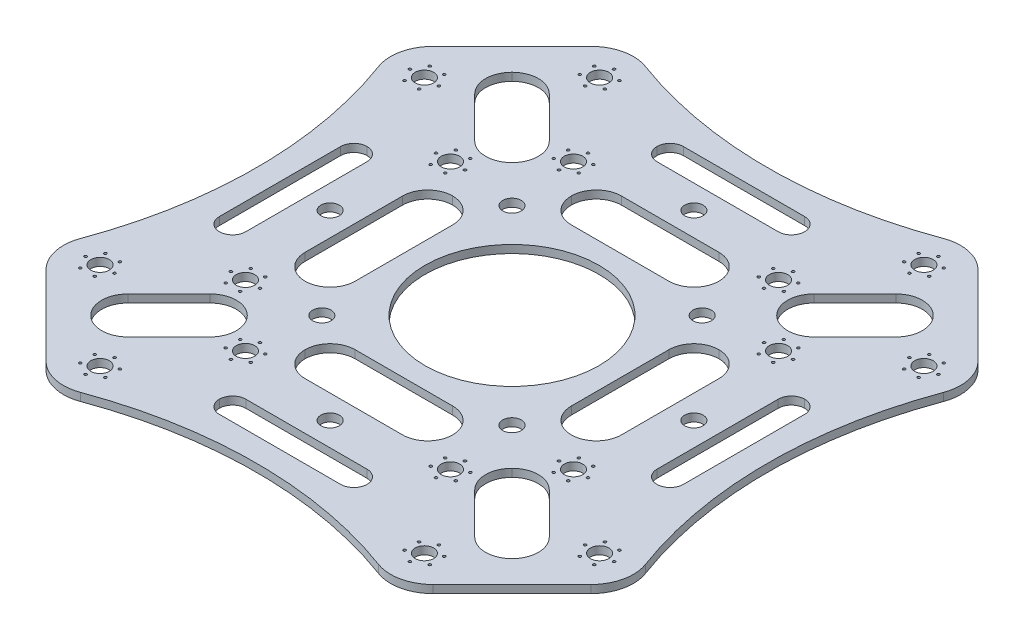
from build123d import *

# Parameters (mm, degrees)
BOSS_EXTRUDE1_DEPTH         = 1.5
FILLET1_R                   = 8
SKETCH2_R                   = 16.5
SKETCH2_W                   = 28
SKETCH2_H                   = 5
SKETCH2_H_2                 = 9.5
CUT_EXTRUDE1_DEPTH          = 77.452226041
FILLET2_R                   = 4.75
FILLET3_R                   = 2.5
FILLET4_R                   = 5
CIRPATTERN1_COUNT           = 4
FILLET2_OF_CIRPATTERN1_R    = 4.75
FILLET3_OF_CIRPATTERN1_R    = 2.5
FILLET4_OF_CIRPATTERN1_R    = 5
SKETCH3_R                   = 1.75
CUT_EXTRUDE2_DEPTH          = 77.452226041
CIRPATTERN2_COUNT           = 4
SKETCH4_R                   = 0.25
CUT_EXTRUDE3_DEPTH          = 77.452226041
CIRPATTERN3_COUNT           = 4
CIRPATTERN3_COPY_1_SKETCH_R = 0.25
CIRPATTERN3_COPY_1_DEPTH    = 77.452226041
CIRPATTERN3_COPY_2_SKETCH_R = 0.25
CIRPATTERN3_COPY_2_DEPTH    = 77.452226041
CIRPATTERN3_COPY_3_SKETCH_R = 0.25
CIRPATTERN3_COPY_3_DEPTH    = 77.452226041
SKETCH5_R                   = 0.25
CUT_EXTRUDE4_DEPTH          = 77.452226041
CIRPATTERN4_COUNT           = 4
CIRPATTERN4_COPY_1_SKETCH_R = 0.25
CIRPATTERN4_COPY_1_DEPTH    = 77.452226041
CIRPATTERN4_COPY_2_SKETCH_R = 0.25
CIRPATTERN4_COPY_2_DEPTH    = 77.452226041
CIRPATTERN4_COPY_3_SKETCH_R = 0.25
CIRPATTERN4_COPY_3_DEPTH    = 77.452226041
CUT_EXTRUDE5_DEPTH          = 0.1


with BuildPart() as part:
    # Sketch1 → Boss-Extrude1 (new body)
    with BuildSketch(Plane(origin=(0, 0, 0), x_dir=(1, 0, 0), z_dir=(0, 1, 0))):
        with BuildLine():
            Line((32.93654628, 55.451801369), (55.451801369, 32.93654628))
            ThreePointArc((55.451801369, 32.93654628), (48.5, 0), (55.451801369, -32.93654628))
            Line((55.451801369, -32.93654628), (32.93654628, -55.451801369))
            ThreePointArc((32.93654628, -55.451801369), (0, -48.5), (-32.93654628, -55.451801369))
            Line((-32.93654628, -55.451801369), (-55.451801369, -32.93654628))
            ThreePointArc((-55.451801369, -32.93654628), (-48.5, 0), (-55.451801369, 32.93654628))
            Line((-55.451801369, 32.93654628), (-32.93654628, 55.451801369))
            ThreePointArc((-32.93654628, 55.451801369), (0, 48.5), (32.93654628, 55.451801369))
        make_face()
    extrude(amount=BOSS_EXTRUDE1_DEPTH)

    # Fillet1
    fillet1_edges = [part.edges().sort_by_distance(p)[0] for p in [
        (32.93654628, 0.75, -55.451801369),
        (55.451801369, 0.75, -32.93654628),
        (55.451801369, 0.75, 32.93654628),
        (32.93654628, 0.75, 55.451801369),
        (-32.93654628, 0.75, 55.451801369),
        (-55.451801369, 0.75, 32.93654628),
        (-55.451801369, 0.75, -32.93654628),
        (-32.93654628, 0.75, -55.451801369),
    ]]
    fillet(fillet1_edges, radius=FILLET1_R)

    # Sketch2 → Cut-Extrude1 (cut, through all)
    with BuildSketch(Plane(origin=(0, 1.5, 0), x_dir=(1, 0, 0), z_dir=(0, 1, 0))):
        with Locations(Location((0, 0, 0), (0, 0, 270))):
            Circle(SKETCH2_R)
        with Locations((0, 41.5)):
            Rectangle(SKETCH2_W, SKETCH2_H)
        with Locations((0, 25.25)):
            Rectangle(SKETCH2_W, SKETCH2_H_2)
        Polygon((36.415999231, 43.487067043), (21.566756826, 28.637824638), (28.637824638, 21.566756826), (43.487067043, 36.415999231), align=None)
    cut_extrude1 = extrude(amount=-CUT_EXTRUDE1_DEPTH, mode=Mode.SUBTRACT)

    # Fillet2
    fillet2_edges = [part.edges().sort_by_distance(p)[0] for p in [
        (14, 0.75, -20.5),
        (14, 0.75, -30),
        (-14, 0.75, -20.5),
        (-14, 0.75, -30),
    ]]
    fillet(fillet2_edges, radius=FILLET2_R - 0.0001)  # a hair under: the kernel refuses the full size

    # Fillet3
    fillet3_edges = [part.edges().sort_by_distance(p)[0] for p in [
        (14, 0.75, -39),
        (14, 0.75, -44),
        (-14, 0.75, -39),
        (-14, 0.75, -44),
    ]]
    fillet(fillet3_edges, radius=FILLET3_R - 0.0001)  # a hair under: the kernel refuses the full size

    # Fillet4
    fillet4_edges = [part.edges().sort_by_distance(p)[0] for p in [
        (43.487067043, 0.75, -36.415999231),
        (21.566756826, 0.75, -28.637824638),
        (28.637824638, 0.75, -21.566756826),
        (36.415999231, 0.75, -43.487067043),
    ]]
    fillet(fillet4_edges, radius=FILLET4_R - 0.0001)  # a hair under: the kernel refuses the full size

    # CirPattern1: Cut-Extrude1 ×4 about axis
    cirpattern1_axis = Axis((0, 0, 0), (0, 1, 0))
    for i in range(1, CIRPATTERN1_COUNT):
        add(cut_extrude1.rotate(cirpattern1_axis, i * 360 / CIRPATTERN1_COUNT), mode=Mode.SUBTRACT)

    # Fillet2 of CirPattern1
    fillet2_of_cirpattern1_edges = [part.edges().sort_by_distance(p)[0] for p in [
        (-20.5, 0.75, -14),
        (-30, 0.75, -14),
        (-20.5, 0.75, 14),
        (-30, 0.75, 14),
        (-14, 0.75, 20.5),
        (-14, 0.75, 30),
        (14, 0.75, 20.5),
        (14, 0.75, 30),
        (20.5, 0.75, 14),
        (30, 0.75, 14),
        (20.5, 0.75, -14),
        (30, 0.75, -14),
    ]]
    fillet(fillet2_of_cirpattern1_edges, radius=FILLET2_OF_CIRPATTERN1_R - 0.0001)  # a hair under: the kernel refuses the full size

    # Fillet3 of CirPattern1
    fillet3_of_cirpattern1_edges = [part.edges().sort_by_distance(p)[0] for p in [
        (-39, 0.75, -14),
        (-44, 0.75, -14),
        (-39, 0.75, 14),
        (-44, 0.75, 14),
        (-14, 0.75, 39),
        (-14, 0.75, 44),
        (14, 0.75, 39),
        (14, 0.75, 44),
        (39, 0.75, 14),
        (44, 0.75, 14),
        (39, 0.75, -14),
        (44, 0.75, -14),
    ]]
    fillet(fillet3_of_cirpattern1_edges, radius=FILLET3_OF_CIRPATTERN1_R - 0.0001)  # a hair under: the kernel refuses the full size

    # Fillet4 of CirPattern1
    fillet4_of_cirpattern1_edges = [part.edges().sort_by_distance(p)[0] for p in [
        (-36.415999231, 0.75, -43.487067043),
        (-28.637824638, 0.75, -21.566756826),
        (-21.566756826, 0.75, -28.637824638),
        (-43.487067043, 0.75, -36.415999231),
        (-43.487067043, 0.75, 36.415999231),
        (-21.566756826, 0.75, 28.637824638),
        (-28.637824638, 0.75, 21.566756826),
        (-36.415999231, 0.75, 43.487067043),
        (36.415999231, 0.75, 43.487067043),
        (28.637824638, 0.75, 21.566756826),
        (21.566756826, 0.75, 28.637824638),
        (43.487067043, 0.75, 36.415999231),
    ]]
    fillet(fillet4_of_cirpattern1_edges, radius=FILLET4_OF_CIRPATTERN1_R - 0.0001)  # a hair under: the kernel refuses the full size

    # Sketch3 → Cut-Extrude2 (cut, through all)
    with BuildSketch(Plane(origin=(0, 1.5, 0), x_dir=(1, 0, 0), z_dir=(0, 1, 0))):
        with Locations(Location((30.759144982, 47.376154339, 0), (0, 0, 270))):
            Circle(SKETCH3_R)
        with Locations(Location((19.445436483, 31.112698372, 0), (0, 0, 270))):
            Circle(SKETCH3_R)
        with Locations(Location((18.03122292, 18.03122292, 0), (0, 0, 270))):
            Circle(SKETCH3_R)
        with Locations(Location((0, 34.5, 0), (0, 0, 270))):
            Circle(SKETCH3_R)
        with Locations(Location((47.376154339, 30.759144982, 0), (0, 0, 90))):
            Circle(SKETCH3_R)
        with Locations(Location((31.112698372, 19.445436483, 0), (0, 0, 90))):
            Circle(SKETCH3_R)
    cut_extrude2 = extrude(amount=-CUT_EXTRUDE2_DEPTH, mode=Mode.SUBTRACT)

    # CirPattern2: Cut-Extrude2 ×4 about axis
    cirpattern2_axis = Axis((0, 0, 0), (0, 1, 0))
    for i in range(1, CIRPATTERN2_COUNT):
        add(cut_extrude2.rotate(cirpattern2_axis, i * 360 / CIRPATTERN2_COUNT), mode=Mode.SUBTRACT)

    # Sketch4 → Cut-Extrude3 (cut, through all)
    with BuildSketch(Plane(origin=(0, 1.5, 0), x_dir=(1, 0, 0), z_dir=(0, 1, 0))):
        with Locations(Location((30.759144982, 50.126154339, 0), (0, 0, 270))):
            Circle(SKETCH4_R)
        with Locations(Location((33.140714842, 48.751154339, 0), (0, 0, 270))):
            Circle(SKETCH4_R)
        with Locations(Location((33.140714842, 46.001154339, 0), (0, 0, 270))):
            Circle(SKETCH4_R)
        with Locations(Location((30.759144982, 44.626154339, 0), (0, 0, 270))):
            Circle(SKETCH4_R)
        with Locations(Location((28.377575121, 46.001154339, 0), (0, 0, 270))):
            Circle(SKETCH4_R)
        with Locations(Location((28.377575121, 48.751154339, 0), (0, 0, 270))):
            Circle(SKETCH4_R)
    cut_extrude3 = extrude(amount=-CUT_EXTRUDE3_DEPTH, mode=Mode.SUBTRACT)

    # Mirror1: Cut-Extrude3 across plane
    add(cut_extrude3.mirror(Plane(origin=(0, 0, 0), x_dir=(-0.7071067811865466, 0, 0.7071067811865486), z_dir=(0.7071067811865487, 0, 0.7071067811865465))), mode=Mode.SUBTRACT)

    # CirPattern3: Cut-Extrude3 ×4 about axis
    cirpattern3_axis = Axis((0, 0, 0), (0, 1, 0))
    for i in range(1, CIRPATTERN3_COUNT):
        add(cut_extrude3.rotate(cirpattern3_axis, i * 360 / CIRPATTERN3_COUNT), mode=Mode.SUBTRACT)

    # CirPattern3 copy 1 sketch → CirPattern3 copy 1 (cut, through all)
    with BuildSketch(Plane(origin=(0, 1.5, 0), x_dir=(-1, 0, 0), z_dir=(0, 1, 0))):
        with Locations((30.759144982, -50.126154339)):
            Circle(CIRPATTERN3_COPY_1_SKETCH_R)
        with Locations((33.140714842, -48.751154339)):
            Circle(CIRPATTERN3_COPY_1_SKETCH_R)
        with Locations((33.140714842, -46.001154339)):
            Circle(CIRPATTERN3_COPY_1_SKETCH_R)
        with Locations((30.759144982, -44.626154339)):
            Circle(CIRPATTERN3_COPY_1_SKETCH_R)
        with Locations((28.377575121, -46.001154339)):
            Circle(CIRPATTERN3_COPY_1_SKETCH_R)
        with Locations((28.377575121, -48.751154339)):
            Circle(CIRPATTERN3_COPY_1_SKETCH_R)
    extrude(amount=-CIRPATTERN3_COPY_1_DEPTH, mode=Mode.SUBTRACT)

    # CirPattern3 copy 2 sketch → CirPattern3 copy 2 (cut, through all)
    with BuildSketch(Plane.ZX.offset(1.5)):
        with Locations((30.759144982, -50.126154339)):
            Circle(CIRPATTERN3_COPY_2_SKETCH_R)
        with Locations((33.140714842, -48.751154339)):
            Circle(CIRPATTERN3_COPY_2_SKETCH_R)
        with Locations((33.140714842, -46.001154339)):
            Circle(CIRPATTERN3_COPY_2_SKETCH_R)
        with Locations((30.759144982, -44.626154339)):
            Circle(CIRPATTERN3_COPY_2_SKETCH_R)
        with Locations((28.377575121, -46.001154339)):
            Circle(CIRPATTERN3_COPY_2_SKETCH_R)
        with Locations((28.377575121, -48.751154339)):
            Circle(CIRPATTERN3_COPY_2_SKETCH_R)
    extrude(amount=-CIRPATTERN3_COPY_2_DEPTH, mode=Mode.SUBTRACT)

    # CirPattern3 copy 3 sketch → CirPattern3 copy 3 (cut, through all)
    with BuildSketch(Plane(origin=(0, 1.5, 0), x_dir=(1, 0, 0), z_dir=(0, 1, 0))):
        with Locations((30.759144982, -50.126154339)):
            Circle(CIRPATTERN3_COPY_3_SKETCH_R)
        with Locations((33.140714842, -48.751154339)):
            Circle(CIRPATTERN3_COPY_3_SKETCH_R)
        with Locations((33.140714842, -46.001154339)):
            Circle(CIRPATTERN3_COPY_3_SKETCH_R)
        with Locations((30.759144982, -44.626154339)):
            Circle(CIRPATTERN3_COPY_3_SKETCH_R)
        with Locations((28.377575121, -46.001154339)):
            Circle(CIRPATTERN3_COPY_3_SKETCH_R)
        with Locations((28.377575121, -48.751154339)):
            Circle(CIRPATTERN3_COPY_3_SKETCH_R)
    extrude(amount=-CIRPATTERN3_COPY_3_DEPTH, mode=Mode.SUBTRACT)

    # Sketch5 → Cut-Extrude4 (cut, through all)
    with BuildSketch(Plane(origin=(0, 1.5, 0), x_dir=(1, 0, 0), z_dir=(0, 1, 0))):
        with Locations(Location((19.445436483, 33.862698372, 0), (0, 0, 270))):
            Circle(SKETCH5_R)
        with Locations(Location((21.827006343, 32.487698372, 0), (0, 0, 270))):
            Circle(SKETCH5_R)
        with Locations(Location((21.827006343, 29.737698372, 0), (0, 0, 270))):
            Circle(SKETCH5_R)
        with Locations(Location((19.445436483, 28.362698372, 0), (0, 0, 270))):
            Circle(SKETCH5_R)
        with Locations(Location((17.063866622, 29.737698372, 0), (0, 0, 270))):
            Circle(SKETCH5_R)
        with Locations(Location((17.063866622, 32.487698372, 0), (0, 0, 270))):
            Circle(SKETCH5_R)
    cut_extrude4 = extrude(amount=-CUT_EXTRUDE4_DEPTH, mode=Mode.SUBTRACT)

    # Mirror2: Cut-Extrude4 across plane
    add(cut_extrude4.mirror(Plane(origin=(0, 0, 0), x_dir=(-0.7071067811865466, 0, 0.7071067811865486), z_dir=(0.7071067811865487, 0, 0.7071067811865465))), mode=Mode.SUBTRACT)

    # CirPattern4: Cut-Extrude4 ×4 about axis
    cirpattern4_axis = Axis((0, 0, 0), (0, 1, 0))
    for i in range(1, CIRPATTERN4_COUNT):
        add(cut_extrude4.rotate(cirpattern4_axis, i * 360 / CIRPATTERN4_COUNT), mode=Mode.SUBTRACT)

    # CirPattern4 copy 1 sketch → CirPattern4 copy 1 (cut, through all)
    with BuildSketch(Plane(origin=(0, 1.5, 0), x_dir=(-1, 0, 0), z_dir=(0, 1, 0))):
        with Locations((19.445436483, -33.862698372)):
            Circle(CIRPATTERN4_COPY_1_SKETCH_R)
        with Locations((21.827006343, -32.487698372)):
            Circle(CIRPATTERN4_COPY_1_SKETCH_R)
        with Locations((21.827006343, -29.737698372)):
            Circle(CIRPATTERN4_COPY_1_SKETCH_R)
        with Locations((19.445436483, -28.362698372)):
            Circle(CIRPATTERN4_COPY_1_SKETCH_R)
        with Locations((17.063866622, -29.737698372)):
            Circle(CIRPATTERN4_COPY_1_SKETCH_R)
        with Locations((17.063866622, -32.487698372)):
            Circle(CIRPATTERN4_COPY_1_SKETCH_R)
    extrude(amount=-CIRPATTERN4_COPY_1_DEPTH, mode=Mode.SUBTRACT)

    # CirPattern4 copy 2 sketch → CirPattern4 copy 2 (cut, through all)
    with BuildSketch(Plane.ZX.offset(1.5)):
        with Locations((19.445436483, -33.862698372)):
            Circle(CIRPATTERN4_COPY_2_SKETCH_R)
        with Locations((21.827006343, -32.487698372)):
            Circle(CIRPATTERN4_COPY_2_SKETCH_R)
        with Locations((21.827006343, -29.737698372)):
            Circle(CIRPATTERN4_COPY_2_SKETCH_R)
        with Locations((19.445436483, -28.362698372)):
            Circle(CIRPATTERN4_COPY_2_SKETCH_R)
        with Locations((17.063866622, -29.737698372)):
            Circle(CIRPATTERN4_COPY_2_SKETCH_R)
        with Locations((17.063866622, -32.487698372)):
            Circle(CIRPATTERN4_COPY_2_SKETCH_R)
    extrude(amount=-CIRPATTERN4_COPY_2_DEPTH, mode=Mode.SUBTRACT)

    # CirPattern4 copy 3 sketch → CirPattern4 copy 3 (cut, through all)
    with BuildSketch(Plane(origin=(0, 1.5, 0), x_dir=(1, 0, 0), z_dir=(0, 1, 0))):
        with Locations((19.445436483, -33.862698372)):
            Circle(CIRPATTERN4_COPY_3_SKETCH_R)
        with Locations((21.827006343, -32.487698372)):
            Circle(CIRPATTERN4_COPY_3_SKETCH_R)
        with Locations((21.827006343, -29.737698372)):
            Circle(CIRPATTERN4_COPY_3_SKETCH_R)
        with Locations((19.445436483, -28.362698372)):
            Circle(CIRPATTERN4_COPY_3_SKETCH_R)
        with Locations((17.063866622, -29.737698372)):
            Circle(CIRPATTERN4_COPY_3_SKETCH_R)
        with Locations((17.063866622, -32.487698372)):
            Circle(CIRPATTERN4_COPY_3_SKETCH_R)
    extrude(amount=-CIRPATTERN4_COPY_3_DEPTH, mode=Mode.SUBTRACT)

    # Sketch6 → Cut-Extrude5 (cut)
    # profile 1 of 6: a face of its own
    with BuildSketch(Plane.XZ):
        Polygon((0.262920673, 16.464242788), (1.218549679, 19.847155449), (1.275340545, 19.839443109), (2.294070513, 16.82041266), (4.065104167, 19.462239583), (4.12119391, 19.454527244), (4.149238782, 15.939102564), (3.809895833, 15.984675481), (3.805689103, 18.496794872), (2.252704327, 16.195713141), (2.166466346, 16.20693109), (1.266225962, 18.85927484), (0.595252404, 16.419370994), align=None)
    # profile 2 of 6: a face of its own
    with BuildSketch(Plane.XZ):
        Polygon((5.979676764, 19.04771511), (7.863591027, 18.366224725), (7.746503688, 18.042306456), (6.190714425, 18.605307257), (5.818418752, 17.576761584), (7.3608867, 17.018668635), (7.244500482, 16.696853732), (5.702032534, 17.25494668), (5.235085418, 15.9655837), (6.777553367, 15.407490751), (6.660466027, 15.083572482), (4.789873079, 15.760155014), align=None)
    # profile 3 of 6: a face of its own
    with BuildSketch(Plane.XZ):
        with BuildLine():
            Line((10.591728797, 16.894790702), (10.431171906, 16.606629645))
            Line((10.431171906, 16.606629645), (9.352145463, 17.206789901))
            Line((9.352145463, 17.206789901), (8.74146838, 16.465003042))
            add(Edge.make_bspline(
                [(8.74146838, 16.465003042), (8.778527567, 16.455893859), (8.850192644, 16.438278515), (8.951979839, 16.405030687), (9.045481047, 16.368526036), (9.102779227, 16.338602187), (9.130590976, 16.324077561)],
                knots=[0, 0, 0, 0, 1.102800941, 2.132597077, 3.093588268, 4, 4, 4, 4], degree=3))
            add(Edge.make_bspline(
                [(9.130590976, 16.324077561), (9.163942134, 16.304357425), (9.229219201, 16.265759884), (9.318800813, 16.198408241), (9.399314347, 16.125351817), (9.470243074, 16.045739085), (9.532677381, 15.960630603), (9.584595178, 15.868661331), (9.627777672, 15.770839744), (9.660025493, 15.667461541), (9.683604955, 15.561251712), (9.695132297, 15.45383946), (9.697185893, 15.346216789), (9.685882613, 15.238479393), (9.665223374, 15.130337383), (9.63219091, 15.022303697), (9.589007802, 14.913903459), (9.551933916, 14.84392495), (9.533034886, 14.808252241)],
                knots=[0, 0, 0, 0, 1.057410552, 2.069633068, 3.054483779, 4.02176546, 4.976650336, 5.931343235, 6.900139714, 7.891195471, 8.883893885, 9.86638428, 10.836567245, 11.817730062, 12.819069236, 13.838729138, 14.898256245, 16, 16, 16, 16], degree=3))
            add(Edge.make_bspline(
                [(9.533034886, 14.808252241), (9.518799, 14.783794218), (9.490671259, 14.735469238), (9.444380928, 14.666203167), (9.393403166, 14.602034649), (9.340461385, 14.540327904), (9.282475269, 14.484024098), (9.222323577, 14.430040402), (9.157726238, 14.38134854), (9.090442276, 14.336564985), (9.021400264, 14.295808995), (8.950416332, 14.260617612), (8.878083004, 14.231310712), (8.805026244, 14.206781008), (8.731223006, 14.186528739), (8.656025524, 14.173725256), (8.579941208, 14.165163107), (8.477104051, 14.160370583), (8.346781938, 14.168560298), (8.191099931, 14.20222255), (8.034854319, 14.254942972), (7.935507026, 14.306515681), (7.884697547, 14.332891664)],
                knots=[0, 0, 0, 0, 0.883251166, 1.745157244, 2.597377281, 3.440084129, 4.28089441, 5.118121159, 5.961427697, 6.803091963, 7.640096218, 8.46221807, 9.273654946, 10.074131309, 10.866858574, 11.659619403, 12.452313102, 13.25557674, 14.8709734, 16.51055, 18.215380298, 20, 20, 20, 20], degree=3))
            add(Edge.make_bspline(
                [(7.884697547, 14.332891664), (7.854915187, 14.3503698), (7.796410097, 14.384704217), (7.715621287, 14.444342424), (7.64132863, 14.507927467), (7.57564073, 14.577668554), (7.51656957, 14.651616616), (7.466263619, 14.731403441), (7.422464188, 14.815684873), (7.386921911, 14.904489104), (7.359736696, 14.996080918), (7.340716135, 15.088973782), (7.329891125, 15.182591428), (7.328799228, 15.276725402), (7.335650439, 15.371572649), (7.352139464, 15.466734693), (7.37652439, 15.562738603), (7.399217431, 15.625463733), (7.410739213, 15.657310735)],
                knots=[0, 0, 0, 0, 1.072881763, 2.107591416, 3.117123134, 4.109009272, 5.081465591, 6.054979886, 7.036352308, 8.030710158, 9.023793053, 10.002714902, 10.975171221, 11.948875288, 12.925178214, 13.927336105, 14.947660533, 16, 16, 16, 16], degree=3))
            Line((7.410739213, 15.657310735), (7.721336169, 15.484834773))
            add(Edge.make_bspline(
                [(7.721336169, 15.484834773), (7.712056317, 15.453446861), (7.694100961, 15.392715162), (7.678398344, 15.302175288), (7.67428317, 15.216297421), (7.679063798, 15.134569533), (7.69707093, 15.056438216), (7.722695239, 14.979844534), (7.760041779, 14.905552938), (7.804945323, 14.833010426), (7.858787447, 14.765193055), (7.919918205, 14.704321881), (7.986938792, 14.650060674), (8.035997798, 14.620499905), (8.060679117, 14.605628042)],
                knots=[0, 0, 0, 0, 1.14545278, 2.21630842, 3.207675026, 4.151000993, 5.072313048, 6.006508688, 6.972664177, 7.97624879, 8.989693372, 9.996508863, 10.992054488, 12, 12, 12, 12], degree=3))
            add(Edge.make_bspline(
                [(8.060679117, 14.605628042), (8.085428267, 14.592673929), (8.134509054, 14.566984236), (8.21187924, 14.538790029), (8.290165631, 14.517705315), (8.370005419, 14.507053481), (8.450790159, 14.502971092), (8.533015374, 14.509149846), (8.616373274, 14.523100321), (8.700054073, 14.545719363), (8.782321191, 14.575154595), (8.860428985, 14.613641816), (8.93451087, 14.658099528), (9.002762179, 14.711537213), (9.066761898, 14.771396508), (9.126776322, 14.838008581), (9.18081036, 14.912939766), (9.212571022, 14.966678288), (9.228748028, 14.994049517)],
                knots=[0, 0, 0, 0, 0.976980117, 1.937478828, 2.876158392, 3.809939936, 4.751752239, 5.703111972, 6.690418528, 7.706561758, 8.734136858, 9.744101462, 10.750214268, 11.753428519, 12.772269276, 13.81526638, 14.887225748, 16, 16, 16, 16], degree=3))
            add(Edge.make_bspline(
                [(9.228748028, 14.994049517), (9.242050904, 15.01930935), (9.268161503, 15.068888805), (9.298917239, 15.145413392), (9.321949209, 15.221848674), (9.33568695, 15.29809257), (9.342205496, 15.374150614), (9.341024449, 15.449870719), (9.330797228, 15.525471902), (9.313457786, 15.600220303), (9.288313892, 15.673177415), (9.255259279, 15.742708803), (9.21483933, 15.80833545), (9.167621601, 15.870756605), (9.112024292, 15.928705482), (9.049076751, 15.98275894), (8.979419034, 16.033801358), (8.928720145, 16.063472358), (8.902726393, 16.078684933)],
                knots=[0, 0, 0, 0, 1.073853241, 2.107735903, 3.098478779, 4.073201836, 5.017651959, 5.967737226, 6.916885626, 7.883359146, 8.851352342, 9.815260991, 10.774664618, 11.747480969, 12.75533291, 13.790449479, 14.867144605, 16, 16, 16, 16], degree=3))
            add(Edge.make_bspline(
                [(8.902726393, 16.078684933), (8.879504701, 16.090906728), (8.831727619, 16.116052255), (8.754918366, 16.14899246), (8.671524723, 16.177858608), (8.582096551, 16.204984758), (8.486178252, 16.227463665), (8.384091584, 16.248185084), (8.275469403, 16.264708268), (8.200698562, 16.273363477), (8.162341778, 16.277803523)],
                knots=[0, 0, 0, 0, 0.815974876, 1.678813898, 2.596119407, 3.559720393, 4.584055445, 5.658932898, 6.799053154, 8, 8, 8, 8], degree=3))
            Line((8.162341778, 16.277803523), (9.279929919, 17.624658491))
            Line((9.279929919, 17.624658491), (10.591728797, 16.894790702))
        make_face()
    # profile 4 of 6: a face of its own
    with BuildSketch(Plane.XZ):
        Polygon((11.633896458, 16.231508412), (13.371977387, 14.848896232), (9.672157676, 13.206868989), (9.538944535, 13.500639021), (12.740967772, 14.928122995), (11.42776665, 15.972794469), align=None)
    # profile 5 of 6: a face of its own
    with BuildSketch(Plane.XZ):
        with BuildLine():
            Line((15.123076854, 13.116333277), (15.176362111, 12.779093694))
            Line((15.176362111, 12.779093694), (13.490865316, 12.518276386))
            add(Edge.make_bspline(
                [(13.490865316, 12.518276386), (13.518665846, 12.501803664), (13.573025804, 12.469593612), (13.64889942, 12.416464581), (13.716754845, 12.359679543), (13.756691894, 12.318339988), (13.776221886, 12.298124143)],
                knots=[0, 0, 0, 0, 1.071341404, 2.094854758, 3.068346979, 4, 4, 4, 4], degree=3))
            add(Edge.make_bspline(
                [(13.776221886, 12.298124143), (13.798204959, 12.272330243), (13.841474131, 12.221560239), (13.897392661, 12.139610472), (13.942989716, 12.053930523), (13.978983105, 11.964810098), (14.005902548, 11.872561272), (14.022679285, 11.776866503), (14.029466274, 11.677735027), (14.027259823, 11.576620356), (14.016475683, 11.475350248), (13.995283281, 11.37698226), (13.964984039, 11.28233289), (13.925422027, 11.191509629), (13.877099638, 11.104025049), (13.818120545, 11.021189414), (13.750827721, 10.941358521), (13.699806089, 10.892621689), (13.673858104, 10.867835681)],
                knots=[0, 0, 0, 0, 1.017734859, 2.003202432, 2.973849341, 3.928309984, 4.886070949, 5.85577769, 6.841320307, 7.866704966, 8.891031237, 9.896385737, 10.884551309, 11.872018108, 12.868431787, 13.881432235, 14.922563601, 16, 16, 16, 16], degree=3))
            add(Edge.make_bspline(
                [(13.673858104, 10.867835681), (13.636535312, 10.83619096), (13.563152921, 10.773972537), (13.440933516, 10.699325264), (13.312825711, 10.641905053), (13.178953328, 10.603434452), (13.041750861, 10.582586386), (12.902704519, 10.582168076), (12.763174138, 10.60081824), (12.624983697, 10.637796986), (12.491724807, 10.693051897), (12.366734646, 10.76446878), (12.250881414, 10.850870206), (12.183575204, 10.919932806), (12.149619322, 10.954774784)],
                knots=[0, 0, 0, 0, 1.033278756, 2.03158609, 3.015916617, 3.993277463, 4.967397967, 5.940816439, 6.922663473, 7.93545395, 8.956754461, 9.963706365, 10.972692908, 12, 12, 12, 12], degree=3))
            add(Edge.make_bspline(
                [(12.149619322, 10.954774784), (12.119488496, 10.990775889), (12.059898688, 11.061975362), (11.987004383, 11.180378434), (11.931406342, 11.306966652), (11.892353519, 11.439854509), (11.870013728, 11.576502629), (11.868221295, 11.714598727), (11.885004245, 11.852458831), (11.921866722, 11.988098244), (11.975579682, 12.118503344), (12.044654924, 12.24058505), (12.128645345, 12.353268452), (12.195664649, 12.418626918), (12.229547207, 12.451669816)],
                knots=[0, 0, 0, 0, 1.011198104, 1.999848962, 2.985722417, 3.983804425, 4.978701612, 5.961376515, 6.95134904, 7.963375367, 8.982377045, 9.984229461, 10.980898665, 12, 12, 12, 12], degree=3))
            add(Edge.make_bspline(
                [(12.229547207, 12.451669816), (12.256852998, 12.475237414), (12.312406592, 12.52318566), (12.406882425, 12.583847022), (12.508840041, 12.640700785), (12.622464958, 12.690882269), (12.750907179, 12.736603214), (12.898407658, 12.775348341), (13.065602446, 12.811474476), (13.184356175, 12.829762373), (13.246874931, 12.839390168)],
                knots=[0, 0, 0, 0, 0.782525581, 1.592047159, 2.432673418, 3.316584453, 4.286317662, 5.390866796, 6.62640303, 8, 8, 8, 8], degree=3))
            Line((13.246874931, 12.839390168), (15.123076854, 13.116333277))
        make_face()
        with BuildLine():
            add(Edge.make_bspline(
                [(13.494370925, 12.155095297), (13.477169204, 12.172968295), (13.443272456, 12.208187825), (13.387413578, 12.254419803), (13.329141713, 12.295030658), (13.266827493, 12.327951201), (13.201633575, 12.35481474), (13.133123591, 12.374311267), (13.061783269, 12.387676359), (12.988321678, 12.39469176), (12.914413405, 12.394465586), (12.842054763, 12.388537724), (12.772046736, 12.375031787), (12.704556223, 12.354750077), (12.639485171, 12.327126648), (12.577114169, 12.292345132), (12.516214971, 12.25200895), (12.479047294, 12.219794276), (12.460216277, 12.2034727)],
                knots=[0, 0, 0, 0, 1.033284532, 2.036132582, 3.017021461, 3.988919418, 4.967628917, 5.951174924, 6.95236549, 7.989591946, 9.022233346, 10.029472314, 11.011521551, 11.988484047, 12.96194313, 13.951693321, 14.962224698, 16, 16, 16, 16], degree=3))
            add(Edge.make_bspline(
                [(12.460216277, 12.2034727), (12.442341744, 12.18627159), (12.407119192, 12.152376046), (12.360909215, 12.096508407), (12.320217283, 12.03826883), (12.287554934, 11.975755913), (12.259538802, 11.910923868), (12.240589228, 11.842111244), (12.225963684, 11.770985411), (12.219293964, 11.697409011), (12.219415157, 11.623516133), (12.225410189, 11.55116637), (12.238712464, 11.481329605), (12.259440118, 11.414314954), (12.286061069, 11.34933781), (12.319874401, 11.286829089), (12.360770206, 11.226668437), (12.392761791, 11.189583591), (12.409034386, 11.170720297)],
                knots=[0, 0, 0, 0, 1.034592827, 2.038710633, 3.020841465, 3.993969992, 4.977649622, 5.962440946, 6.966748244, 8.005287986, 9.039236866, 10.047751151, 11.03104381, 11.999909903, 12.970836058, 13.957172002, 14.960910718, 16, 16, 16, 16], degree=3))
            add(Edge.make_bspline(
                [(12.409034386, 11.170720297), (12.426234735, 11.152844752), (12.460128777, 11.117620206), (12.516007343, 11.071424734), (12.574376071, 11.030560741), (12.636971162, 10.998177115), (12.702053729, 10.971021632), (12.770162054, 10.950611989), (12.841637501, 10.937494947), (12.915079146, 10.930408143), (12.988994176, 10.930649653), (13.061346009, 10.936587408), (13.131374082, 10.950040574), (13.198705377, 10.970495226), (13.263865136, 10.997283895), (13.326380559, 11.031074707), (13.386539395, 11.071976615), (13.42362449, 11.10396736), (13.442487912, 11.120239527)],
                knots=[0, 0, 0, 0, 1.034198846, 2.037934278, 3.019691108, 4.001060504, 4.971616924, 5.958781859, 6.96085834, 7.999002598, 9.032557743, 10.040687978, 11.023606193, 12.001433165, 12.971989585, 13.957949926, 14.961306411, 16, 16, 16, 16], degree=3))
            add(Edge.make_bspline(
                [(13.442487912, 11.120239527), (13.4606535, 11.137383319), (13.496463346, 11.171178896), (13.542565065, 11.227913523), (13.582790279, 11.286958204), (13.61698535, 11.348944309), (13.64333939, 11.414541949), (13.664049585, 11.48274531), (13.677101164, 11.554251655), (13.684206193, 11.627684697), (13.683959787, 11.701602038), (13.678023305, 11.773953271), (13.664569809, 11.843981499), (13.644115245, 11.911312753), (13.617326552, 11.976472523), (13.583535746, 12.038987943), (13.542633837, 12.09914678), (13.510643092, 12.136231875), (13.494370925, 12.155095297)],
                knots=[0, 0, 0, 0, 1.039329228, 2.04883095, 3.036941795, 4.012653423, 4.990547474, 5.976017911, 6.976374298, 8.01273655, 9.044517566, 10.050917317, 11.032148322, 12.008296826, 12.977187256, 13.961455166, 14.963089359, 16, 16, 16, 16], degree=3))
        make_face(mode=Mode.SUBTRACT)
    # profile 6 of 6: a face of its own
    with BuildSketch(Plane.XZ):
        with BuildLine():
            Line((15.692202739, 10.955095556), (15.499394246, 11.254474563))
            add(Edge.make_bspline(
                [(15.499394246, 11.254474563), (15.533593706, 11.266419905), (15.600394146, 11.289752264), (15.701199084, 11.315742394), (15.799892426, 11.333422599), (15.896223654, 11.343205881), (15.990513787, 11.345756809), (16.082446099, 11.339133113), (16.172463242, 11.32555825), (16.259524386, 11.302558453), (16.343507282, 11.273644741), (16.423082329, 11.236749381), (16.498372513, 11.193844509), (16.56964586, 11.144840581), (16.635637226, 11.088204342), (16.697461083, 11.02554134), (16.755595769, 10.956655334), (16.789669125, 10.906345738), (16.806986393, 10.880776646)],
                knots=[0, 0, 0, 0, 1.174121195, 2.293364013, 3.370972773, 4.422013105, 5.430055838, 6.4250274, 7.406695285, 8.377068436, 9.340434334, 10.282983711, 11.216258723, 12.147408839, 13.082711844, 14.031091103, 14.999331824, 16, 16, 16, 16], degree=3))
            add(Edge.make_bspline(
                [(16.806986393, 10.880776646), (16.829853717, 10.842228589), (16.875126986, 10.765910232), (16.926894042, 10.643629001), (16.960830334, 10.516321302), (16.980729758, 10.386515065), (16.984322041, 10.256952662), (16.971877314, 10.1310595), (16.943069827, 10.010310832), (16.89727027, 9.896757824), (16.838701506, 9.791537756), (16.768178723, 9.697704118), (16.687084331, 9.615435346), (16.624935585, 9.571383508), (16.593845368, 9.549346358)],
                knots=[0, 0, 0, 0, 1.078059655, 2.134368041, 3.183808378, 4.241942709, 5.288665535, 6.295113116, 7.278869882, 8.26604669, 9.233176389, 10.169261908, 11.084164229, 12, 12, 12, 12], degree=3))
            add(Edge.make_bspline(
                [(16.593845368, 9.549346358), (16.562329912, 9.530362935), (16.500463854, 9.493097743), (16.40011878, 9.454777624), (16.297818566, 9.43026119), (16.192387438, 9.422097613), (16.084630914, 9.428647266), (15.974346202, 9.450045876), (15.86176784, 9.487128951), (15.788382221, 9.521657662), (15.750395848, 9.539530652)],
                knots=[0, 0, 0, 0, 0.99399346, 1.95124762, 2.893230901, 3.832385813, 4.801766007, 5.806527293, 6.864599459, 8, 8, 8, 8], degree=3))
            add(Edge.make_bspline(
                [(15.750395848, 9.539530652), (15.757479338, 9.495700539), (15.771397861, 9.40957767), (15.770723843, 9.279734335), (15.757635313, 9.152571763), (15.734100983, 9.071161836), (15.722350977, 9.030516229)],
                knots=[0, 0, 0, 0, 1.032737647, 2.029251639, 3.016062711, 4, 4, 4, 4], degree=3))
            add(Edge.make_bspline(
                [(15.722350977, 9.030516229), (15.712735915, 9.00277206), (15.693699147, 8.947841645), (15.657944098, 8.869400327), (15.616146015, 8.795911287), (15.569197924, 8.727055923), (15.516446155, 8.662698019), (15.457227787, 8.604151945), (15.393394122, 8.549394873), (15.346871517, 8.517801321), (15.323412675, 8.501870396)],
                knots=[0, 0, 0, 0, 1.042126053, 2.06329533, 3.055464116, 4.040528978, 5.019036602, 6.004765266, 6.993910677, 8, 8, 8, 8], degree=3))
            add(Edge.make_bspline(
                [(15.323412675, 8.501870396), (15.281277826, 8.476993706), (15.197215501, 8.42736276), (15.059010325, 8.375417496), (14.914074024, 8.339658206), (14.788295567, 8.327241016), (14.686512224, 8.324820127), (14.61039082, 8.329347769), (14.535643623, 8.338229359), (14.462142225, 8.352534525), (14.389819619, 8.371175199), (14.318977848, 8.396021603), (14.249381929, 8.425468738), (14.158664962, 8.471498966), (14.049693417, 8.539528038), (13.931989786, 8.641108656), (13.821778588, 8.755836174), (13.76127437, 8.844460701), (13.730463957, 8.889590749)],
                knots=[0, 0, 0, 0, 1.283843007, 2.561367321, 3.863388662, 5.197594625, 5.873343536, 6.537719372, 7.19976296, 7.850251871, 8.504269001, 9.160819306, 9.821351084, 10.488842747, 11.83331583, 13.184422797, 14.56623062, 16, 16, 16, 16], degree=3))
            add(Edge.make_bspline(
                [(13.730463957, 8.889590749), (13.711241846, 8.920845624), (13.673448738, 8.982296674), (13.626620856, 9.07814186), (13.588203132, 9.174299195), (13.560269679, 9.271378952), (13.541174665, 9.368487489), (13.530981877, 9.466128481), (13.53132394, 9.564283388), (13.540297395, 9.662905389), (13.559143507, 9.760899147), (13.588386881, 9.857758414), (13.62684878, 9.95317707), (13.675952241, 10.046995351), (13.734300473, 10.139614104), (13.802430862, 10.231086479), (13.881561962, 10.320093597), (13.939298409, 10.3769967), (13.968845368, 10.406117191)],
                knots=[0, 0, 0, 0, 1.043349901, 2.051358214, 3.030445865, 3.985743681, 4.92067163, 5.842912562, 6.773741541, 7.708574919, 8.656556431, 9.607354992, 10.582733279, 11.578941296, 12.61566048, 13.694095619, 14.819940162, 16, 16, 16, 16], degree=3))
            Line((13.968845368, 10.406117191), (14.153941521, 10.119358377))
            add(Edge.make_bspline(
                [(14.153941521, 10.119358377), (14.135017325, 10.098048203), (14.098299531, 10.056701), (14.048613054, 9.993400946), (14.004454739, 9.931901425), (13.968249158, 9.8701511), (13.936367758, 9.810681426), (13.911595013, 9.751766073), (13.89276619, 9.694117953), (13.885479348, 9.655313244), (13.881906265, 9.63628546)],
                knots=[0, 0, 0, 0, 1.216923955, 2.361144653, 3.435628361, 4.447310857, 5.416133084, 6.315243634, 7.173884297, 8, 8, 8, 8], degree=3))
            add(Edge.make_bspline(
                [(13.881906265, 9.63628546), (13.878837687, 9.612485688), (13.872718075, 9.565022209), (13.872448653, 9.493350613), (13.878435602, 9.421877717), (13.893079651, 9.35092611), (13.913300279, 9.279752143), (13.940829587, 9.208575577), (13.975937004, 9.137918806), (14.003789936, 9.092251686), (14.017923893, 9.069077928)],
                knots=[0, 0, 0, 0, 0.964303424, 1.923093873, 2.876200428, 3.843979161, 4.831682514, 5.849344413, 6.908650859, 8, 8, 8, 8], degree=3))
            add(Edge.make_bspline(
                [(14.017923893, 9.069077928), (14.035301783, 9.043559135), (14.069225025, 8.9937441), (14.125611215, 8.925111642), (14.186049991, 8.864637692), (14.249990181, 8.811899896), (14.317013578, 8.766604943), (14.387503022, 8.728802599), (14.46223622, 8.700578252), (14.538912124, 8.678756926), (14.616434342, 8.664780503), (14.692974089, 8.658565803), (14.76789083, 8.65896306), (14.841015356, 8.667362786), (14.912164774, 8.683659988), (14.98131217, 8.707173106), (15.049158269, 8.736913318), (15.091613822, 8.76288148), (15.113076137, 8.776009018)],
                knots=[0, 0, 0, 0, 1.170244982, 2.284425979, 3.36217341, 4.407145424, 5.422194441, 6.42510259, 7.43222991, 8.444955449, 9.444412586, 10.413594824, 11.352947631, 12.280650339, 13.198567329, 14.114900336, 15.047036283, 16, 16, 16, 16], degree=3))
            add(Edge.make_bspline(
                [(15.113076137, 8.776009018), (15.140604293, 8.79530098), (15.195378823, 8.833687427), (15.265986052, 8.905701935), (15.325092193, 8.988181202), (15.373991259, 9.078778158), (15.410519697, 9.175862332), (15.432517634, 9.276970947), (15.439255126, 9.380375627), (15.433489, 9.468315906), (15.420630464, 9.541449632), (15.404657692, 9.600978876), (15.384621661, 9.665153598), (15.3572193, 9.733034221), (15.325814607, 9.805806574), (15.289435948, 9.88327089), (15.246350201, 9.964255904), (15.215321741, 10.01939673), (15.199314118, 10.047843954)],
                knots=[0, 0, 0, 0, 1.126029206, 2.240532171, 3.36358141, 4.521353406, 5.685084806, 6.832453847, 7.979983649, 9.150983831, 9.780108259, 10.468592204, 11.21751979, 12.034421294, 12.922996553, 13.877075543, 14.904780501, 16, 16, 16, 16], degree=3))
            Line((15.199314118, 10.047843954), (15.468544887, 10.221722159))
            add(Edge.make_bspline(
                [(15.468544887, 10.221722159), (15.490632716, 10.189506516), (15.534003765, 10.126248771), (15.607984879, 10.040208077), (15.68842522, 9.964916882), (15.77302923, 9.899944359), (15.859816141, 9.847940965), (15.945075418, 9.808208948), (16.028512458, 9.783636847), (16.109641904, 9.774389692), (16.18757801, 9.778286964), (16.262322985, 9.792008396), (16.333835953, 9.817298381), (16.377098714, 9.842843775), (16.398933509, 9.855736582)],
                knots=[0, 0, 0, 0, 1.263473914, 2.480922394, 3.663474503, 4.823757462, 5.926323811, 6.931620795, 7.860428772, 8.728260848, 9.561109602, 10.376991171, 11.180864478, 12, 12, 12, 12], degree=3))
            add(Edge.make_bspline(
                [(16.398933509, 9.855736582), (16.414394105, 9.866376957), (16.444869118, 9.887350635), (16.485539163, 9.924523348), (16.522688532, 9.964168745), (16.553072554, 10.008981531), (16.580433085, 10.056519996), (16.602681149, 10.107990527), (16.619365306, 10.16361395), (16.632029351, 10.221706814), (16.638925802, 10.281830623), (16.640320262, 10.342374232), (16.636291611, 10.40276136), (16.625716531, 10.462704445), (16.608451537, 10.521924594), (16.586006456, 10.581146612), (16.557279965, 10.640010218), (16.534099163, 10.677864978), (16.522330945, 10.697082736)],
                knots=[0, 0, 0, 0, 0.951011753, 1.874578189, 2.789351104, 3.700428573, 4.613663536, 5.569540584, 6.537110754, 7.555640077, 8.582142892, 9.602051402, 10.624162741, 11.647511087, 12.68328397, 13.749023405, 14.857244783, 16, 16, 16, 16], degree=3))
            add(Edge.make_bspline(
                [(16.522330945, 10.697082736), (16.501240511, 10.726774071), (16.460117069, 10.78466809), (16.384576224, 10.858198207), (16.299156355, 10.915711004), (16.220735999, 10.950848016), (16.153568442, 10.971799589), (16.098479186, 10.982002274), (16.039864025, 10.987842523), (15.977559718, 10.991367915), (15.911543463, 10.987560907), (15.841568048, 10.981538051), (15.767756607, 10.971142571), (15.717853246, 10.960543511), (15.692202739, 10.955095556)],
                knots=[0, 0, 0, 0, 1.399603338, 2.72903391, 4.031287718, 5.34369088, 6.020871557, 6.735318366, 7.49520269, 8.287558958, 9.133831675, 10.036943324, 10.990981819, 12, 12, 12, 12], degree=3))
        make_face()
    extrude(amount=-CUT_EXTRUDE5_DEPTH, mode=Mode.SUBTRACT)


solid = part.part
